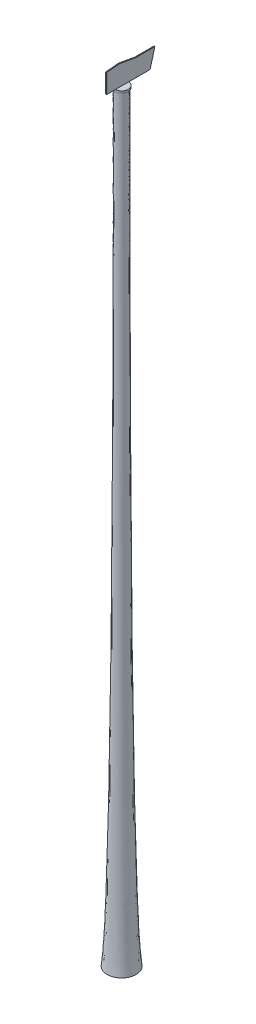
from build123d import *

# Parameters (mm, degrees)
AUFSATZ_LINEAR_AUSTRAGEN1_DEPTH      = 50
AUFSATZ_LINEAR_AUSTRAGEN1_DEPTH_BACK = 50
VERRUNDUNG1_R                        = 10


with BuildPart() as part:
    # Skizze2 → Aufsatz-Linear austragen1 (new, two sides: drawn at the far end of the back side and taken through both)
    with BuildSketch(Plane(origin=(0, 0, 0), x_dir=(0, 0, -1), z_dir=(1, 0, 0)).offset(-AUFSATZ_LINEAR_AUSTRAGEN1_DEPTH_BACK)):
        Polygon((500, -1000), (500, 1000), (1850, 1118.10969576), (3500, 827.170177591), (5500, 827.170177591), (5010.41122648, -1000), align=None)
    extrude(amount=AUFSATZ_LINEAR_AUSTRAGEN1_DEPTH + AUFSATZ_LINEAR_AUSTRAGEN1_DEPTH_BACK)

    # Verrundung1
    verrundung1_edges = [part.edges().sort_by_distance(p)[0] for p in [
        (0, -1000, -5010.41122648),
        (-50, -86.414911204, -5255.20561324),
        (-50, -1000, -2755.20561324),
        (-50, 0, -500),
        (0, -1000, -500),
        (50, 0, -500),
        (50, -86.414911204, -5255.20561324),
        (50, -1000, -2755.20561324),
        (-50, 827.170177591, -4500),
        (0, 827.170177591, -5500),
        (50, 827.170177591, -4500),
        (-50, 972.639936676, -2675),
        (0, 827.170177591, -3500),
        (50, 972.639936676, -2675),
        (-50, 1059.05484788, -1175),
        (0, 1118.10969576, -1850),
        (50, 1059.05484788, -1175),
        (0, 1000, -500),
    ]]
    fillet(verrundung1_edges, radius=VERRUNDUNG1_R)

    # Skizze3 → Rotation1 (revolve)
    with BuildSketch(Plane(origin=(0, 0, 0), x_dir=(0, 0, -1), z_dir=(1, 0, 0))):
        with BuildLine():
            Line((2100, -990), (1400, -990))
            Line((1400, -990), (1400, -1190))
            Line((1400, -1190), (1450, -1190))
            Line((1450, -1190), (1450, -1000))
            Line((1450, -1000), (1480, -1000))
            Line((1480, -1000), (1480, -1190))
            add(Edge.make_bspline(
                [(1480, -1190), (1480, -1545.39669448), (1606.448282077, -71462.373072549), (600, -80000)],
                knots=[0, 0, 0, 0, 1, 1, 1, 1], degree=3))
            Line((600, -80000), (2100, -80000))
            Line((2100, -80000), (2100, -990))
        make_face()
    revolve(axis=Axis((0, 0, -2100), (0, -1, 0)))


solid = part.part
